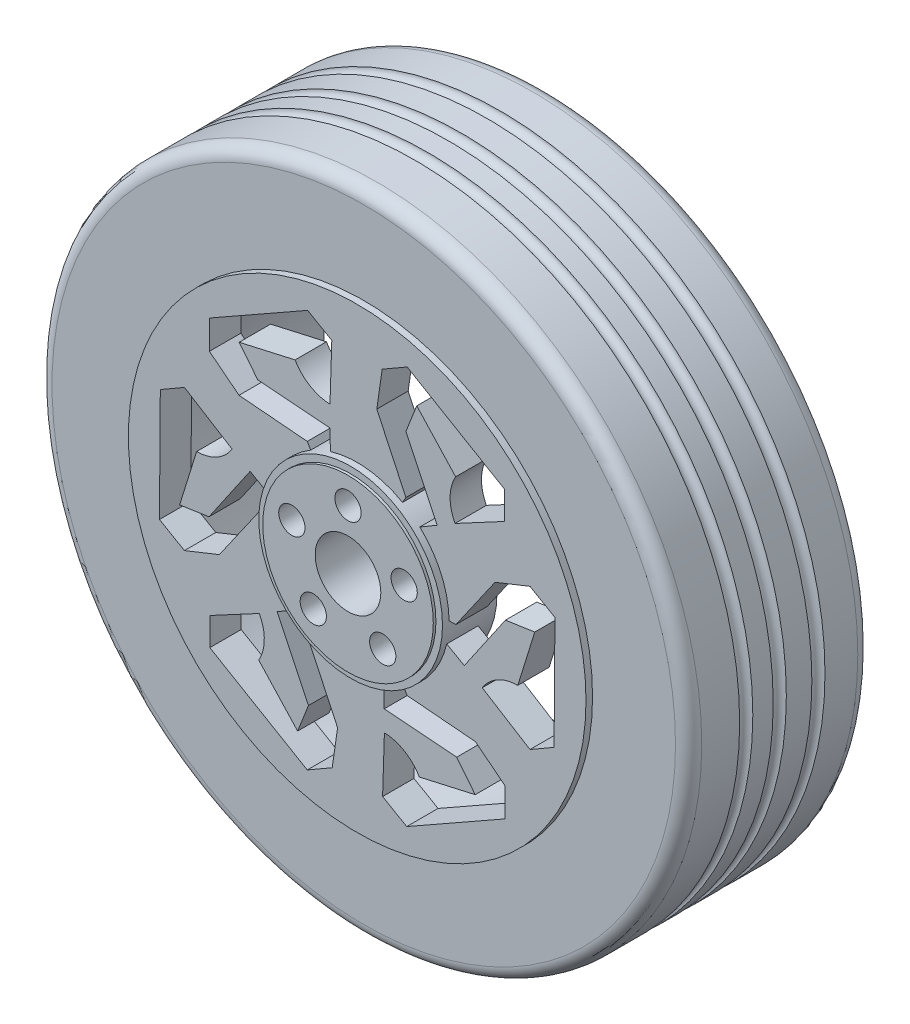
from build123d import *

# Parameters (mm, degrees)
SKETCH2_R                = 247.55
BOSS_EXTRUDE1_DEPTH      = 138.9
FILLET1_R                = 10
FILLET2_R                = 10
SKETCH3_R                = 174.35
BOSS_EXTRUDE2_DEPTH      = 5
CUT_EXTRUDE1_DEPTH       = 30
CUT_SWEEP1_PROFILE_R     = 5
CUT_SWEEP2_PROFILE_R     = 5
CUT_SWEEP3_PROFILE_R     = 5
F_3DSKETCH4_R            = 25
CUT_EXTRUDE2_DEPTH       = 179
SKETCH23_R               = 169.35
CUT_EXTRUDE4_DEPTH       = 120
BOSS_EXTRUDE6_DEPTH      = 5
BOSS_EXTRUDE6_DEPTH_BACK = 36.503
SKETCH113_R              = 70
SKETCH114_R              = 65
BOSS_EXTRUDE7_DEPTH      = 2
SKETCH115_R              = 25
CUT_EXTRUDE6_DEPTH       = 82
SKETCH116_R              = 10
CUT_EXTRUDE7_DEPTH       = 20
SKETCH117_R              = 5
CUT_EXTRUDE8_DEPTH       = 30


with BuildPart() as part:
    # Sketch2 → Boss-Extrude1 (new body)
    with BuildSketch(Plane.XY):
        Circle(SKETCH2_R)
    extrude(amount=BOSS_EXTRUDE1_DEPTH)

    # Fillet1
    fillet1_edges = [part.edges().sort_by_distance(p)[0] for p in [
        (-247.55, 0, 138.9),
    ]]
    fillet(fillet1_edges, radius=FILLET1_R)

    # Fillet2
    fillet2_edges = [part.edges().sort_by_distance(p)[0] for p in [
        (-247.55, 0, 0),
    ]]
    fillet(fillet2_edges, radius=FILLET2_R)

    # Sketch3 → Boss-Extrude2 (add)
    with BuildSketch(Plane.XY.offset(138.9)):
        Circle(SKETCH3_R)
    extrude(amount=BOSS_EXTRUDE2_DEPTH)

    # Sketch5 → Cut-Extrude1 (cut)
    with BuildSketch(Plane.XY.offset(143.9)):
        with BuildLine():
            Line((105.003706731, 43.369407929), (131.633696581, 54.021395774))
            Line((131.633696581, 54.021395774), (150.665269372, 43.031925067))
            Line((150.665269372, 43.031925067), (150.344554361, -0.360940867))
            Line((150.344554361, -0.360940867), (150.02910614, -43.041207894))
            Line((150.02910614, -43.041207894), (131.640430833, -53.657914533))
            Line((131.640430833, -53.657914533), (95.29019948, -31.084252667))
            ThreePointArc((95.29019948, -31.084252667), (106.873400183, -20.029907867), (122.363240346, -15.976029572))
            Line((122.363240346, -15.976029572), (135.299603851, 25.697677813))
            Line((135.299603851, 25.697677813), (112.925565246, 22.34468352))
            Line((112.925565246, 22.34468352), (81.592210025, -23.310129617))
            Line((81.592210025, -23.310129617), (40.25767623, 0.148769441))
            Line((40.25767623, 0.148769441), (75.177682959, 0.55093352))
            Line((75.177682959, 0.55093352), (105.003706731, 43.369407929))
        make_face()
        with BuildLine():
            Line((90.060862379, -69.251173556), (112.600749379, -86.987427346))
            Line((112.600749379, -86.987427346), (112.599374968, -108.963988211))
            Line((112.599374968, -108.963988211), (74.859693221, -130.38267383))
            Line((74.859693221, -130.38267383), (37.739773625, -151.449621172))
            Line((37.739773625, -151.449621172), (19.351098317, -140.832914533))
            Line((19.351098317, -140.832914533), (20.725347273, -98.065859815))
            ThreePointArc((20.725347273, -98.065859815), (36.090291044, -102.570033481), (47.345972712, -113.957689415))
            Line((47.345972712, -113.957689415), (89.90464373, -104.32405515))
            Line((89.90464373, -104.32405515), (75.813846191, -86.62406648))
            Line((75.813846191, -86.62406648), (20.608940598, -82.315991441))
            Line((20.608940598, -82.315991441), (20.25767623, -34.789785592))
            Line((20.25767623, -34.789785592), (38.065963903, -64.83031648))
            Line((38.065963903, -64.83031648), (90.060862379, -69.251173556))
        make_face()
        with BuildLine():
            Line((19.032947202, 141.008823121), (38.065894405, 151.995913278))
            Line((38.065894405, 151.995913278), (75.48486114, 130.021732964))
            Line((75.48486114, 130.021732964), (112.289332516, 108.408413278))
            Line((112.289332516, 108.408413278), (112.289332516, 87.175))
            Line((112.289332516, 87.175), (74.564852207, 66.981607148))
            ThreePointArc((74.564852207, 66.981607148), (70.78310914, 82.540125614), (75.017267633, 97.981659843))
            Line((75.017267633, 97.981659843), (45.394960121, 130.021732964))
            Line((45.394960121, 130.021732964), (37.111719056, 108.96875))
            Line((37.111719056, 108.96875), (60.983269426, 59.005861824))
            Line((60.983269426, 59.005861824), (20, 34.938555033))
            Line((20, 34.938555033), (37.111719056, 65.38125))
            Line((37.111719056, 65.38125), (14.942844352, 112.620581485))
            Line((14.942844352, 112.620581485), (19.032947202, 141.008823121))
        make_face()
        with BuildLine():
            Line((-14.942844352, -112.620581485), (-19.032947202, -141.008823121))
            Line((-19.032947202, -141.008823121), (-38.065894405, -151.995913278))
            Line((-38.065894405, -151.995913278), (-75.48486114, -130.021732964))
            Line((-75.48486114, -130.021732964), (-112.289332516, -108.408413278))
            Line((-112.289332516, -108.408413278), (-112.289332516, -87.175))
            Line((-112.289332516, -87.175), (-74.564852207, -66.981607148))
            ThreePointArc((-74.564852207, -66.981607148), (-70.78310914, -82.540125614), (-75.017267633, -97.981659843))
            Line((-75.017267633, -97.981659843), (-45.394960121, -130.021732964))
            Line((-45.394960121, -130.021732964), (-37.111719056, -108.96875))
            Line((-37.111719056, -108.96875), (-60.983269426, -59.005861824))
            Line((-60.983269426, -59.005861824), (-20, -34.938555033))
            Line((-20, -34.938555033), (-37.111719056, -65.38125))
            Line((-37.111719056, -65.38125), (-14.942844352, -112.620581485))
        make_face()
        with BuildLine():
            Line((-105.003706731, -43.369407929), (-131.633696581, -54.021395774))
            Line((-131.633696581, -54.021395774), (-150.665269372, -43.031925067))
            Line((-150.665269372, -43.031925067), (-150.344554361, 0.360940867))
            Line((-150.344554361, 0.360940867), (-150.02910614, 43.041207894))
            Line((-150.02910614, 43.041207894), (-131.640430833, 53.657914533))
            Line((-131.640430833, 53.657914533), (-95.29019948, 31.084252667))
            ThreePointArc((-95.29019948, 31.084252667), (-106.873400183, 20.029907867), (-122.363240346, 15.976029572))
            Line((-122.363240346, 15.976029572), (-135.299603851, -25.697677813))
            Line((-135.299603851, -25.697677813), (-112.925565246, -22.34468352))
            Line((-112.925565246, -22.34468352), (-81.592210025, 23.310129617))
            Line((-81.592210025, 23.310129617), (-40.25767623, -0.148769441))
            Line((-40.25767623, -0.148769441), (-75.177682959, -0.55093352))
            Line((-75.177682959, -0.55093352), (-105.003706731, -43.369407929))
        make_face()
        with BuildLine():
            Line((-90.060862379, 69.251173556), (-112.600749379, 86.987427346))
            Line((-112.600749379, 86.987427346), (-112.599374968, 108.963988211))
            Line((-112.599374968, 108.963988211), (-74.859693221, 130.38267383))
            Line((-74.859693221, 130.38267383), (-37.739773625, 151.449621172))
            Line((-37.739773625, 151.449621172), (-19.351098317, 140.832914533))
            Line((-19.351098317, 140.832914533), (-20.725347273, 98.065859815))
            ThreePointArc((-20.725347273, 98.065859815), (-36.090291044, 102.570033481), (-47.345972712, 113.957689415))
            Line((-47.345972712, 113.957689415), (-89.90464373, 104.32405515))
            Line((-89.90464373, 104.32405515), (-75.813846191, 86.62406648))
            Line((-75.813846191, 86.62406648), (-20.608940598, 82.315991441))
            Line((-20.608940598, 82.315991441), (-20.25767623, 34.789785592))
            Line((-20.25767623, 34.789785592), (-38.065963903, 64.83031648))
            Line((-38.065963903, 64.83031648), (-90.060862379, 69.251173556))
        make_face()
    extrude(amount=-CUT_EXTRUDE1_DEPTH, mode=Mode.SUBTRACT)

    # Cut-Sweep1: sweep along a path in Sketch16
    with BuildLine(Plane.XY.offset(40)) as cut_sweep1_path:
        CenterArc((0, 0), 247.55, 0, 360)
    # Cut-Sweep1 profile (on start of the path) → Cut-Sweep1 (sweep, cut)
    with BuildSketch(Plane(origin=(247.55, 0, 40), x_dir=(0, 0, 1), z_dir=(0, 1, 0))):
        Circle(CUT_SWEEP1_PROFILE_R)
    sweep(path=cut_sweep1_path.line, mode=Mode.SUBTRACT)

    # Cut-Sweep2: sweep along a path in Sketch15
    with BuildLine(Plane.XY.offset(69.45)) as cut_sweep2_path:
        CenterArc((0, 0), 247.55, 0, 360)
    # Cut-Sweep2 profile (on start of the path) → Cut-Sweep2 (sweep, cut)
    with BuildSketch(Plane(origin=(247.55, 0, 69.45), x_dir=(0, 0, 1), z_dir=(0, 1, 0))):
        Circle(CUT_SWEEP2_PROFILE_R)
    sweep(path=cut_sweep2_path.line, mode=Mode.SUBTRACT)

    # Cut-Sweep3: sweep along a path in Sketch14
    with BuildLine(Plane.XY.offset(95)) as cut_sweep3_path:
        CenterArc((0, 0), 247.55, 0, 360)
    # Cut-Sweep3 profile (on start of the path) → Cut-Sweep3 (sweep, cut)
    with BuildSketch(Plane(origin=(247.55, 0, 95), x_dir=(0, 0, 1), z_dir=(0, 1, 0))):
        Circle(CUT_SWEEP3_PROFILE_R)
    sweep(path=cut_sweep3_path.line, mode=Mode.SUBTRACT)

    # 3DSketch4 → Cut-Extrude2 (cut)
    with BuildSketch(Plane.XY):
        Circle(F_3DSKETCH4_R)
    extrude(amount=CUT_EXTRUDE2_DEPTH, mode=Mode.SUBTRACT)

    # Sketch23 → Cut-Extrude4 (cut)
    with BuildSketch(Plane(origin=(0, 0, 0), x_dir=(-1, 0, 0), z_dir=(0, 0, -1))):
        Circle(SKETCH23_R)
    extrude(amount=-CUT_EXTRUDE4_DEPTH, mode=Mode.SUBTRACT)

    # Sketch113 → Boss-Extrude6 (add, two sides: drawn at the far end of the back side and taken through both)
    with BuildSketch(Plane.XY.offset(143.9).offset(-BOSS_EXTRUDE6_DEPTH_BACK)):
        Circle(SKETCH113_R)
    extrude(amount=BOSS_EXTRUDE6_DEPTH + BOSS_EXTRUDE6_DEPTH_BACK)

    # Sketch114 → Boss-Extrude7 (add)
    with BuildSketch(Plane.XY.offset(148.9)):
        Circle(SKETCH114_R)
    extrude(amount=BOSS_EXTRUDE7_DEPTH)

    # Sketch115 → Cut-Extrude6 (cut)
    with BuildSketch(Plane.XY.offset(150.9)):
        Circle(SKETCH115_R)
    extrude(amount=-CUT_EXTRUDE6_DEPTH, mode=Mode.SUBTRACT)

    # Sketch116 → Cut-Extrude7 (cut)
    with BuildSketch(Plane.XY.offset(150.9)):
        with Locations((0, 45)):
            Circle(SKETCH116_R)
        with Locations((42.797543233, 13.905764747)):
            Circle(SKETCH116_R)
        with Locations((26.450336353, -36.405764747)):
            Circle(SKETCH116_R)
        with Locations((-26.450336353, -36.405764747)):
            Circle(SKETCH116_R)
        with Locations((-42.797543233, 13.905764747)):
            Circle(SKETCH116_R)
    extrude(amount=-CUT_EXTRUDE7_DEPTH, mode=Mode.SUBTRACT)

    # Sketch117 → Cut-Extrude8 (cut)
    with BuildSketch(Plane.XY.offset(130.9)):
        with Locations((0, 45)):
            Circle(SKETCH117_R)
        with Locations((42.797543233, 13.905764747)):
            Circle(SKETCH117_R)
        with Locations((26.450336353, -36.405764747)):
            Circle(SKETCH117_R)
        with Locations((-26.450336353, -36.405764747)):
            Circle(SKETCH117_R)
        with Locations((-42.797543233, 13.905764747)):
            Circle(SKETCH117_R)
    extrude(amount=-CUT_EXTRUDE8_DEPTH, mode=Mode.SUBTRACT)


solid = part.part
